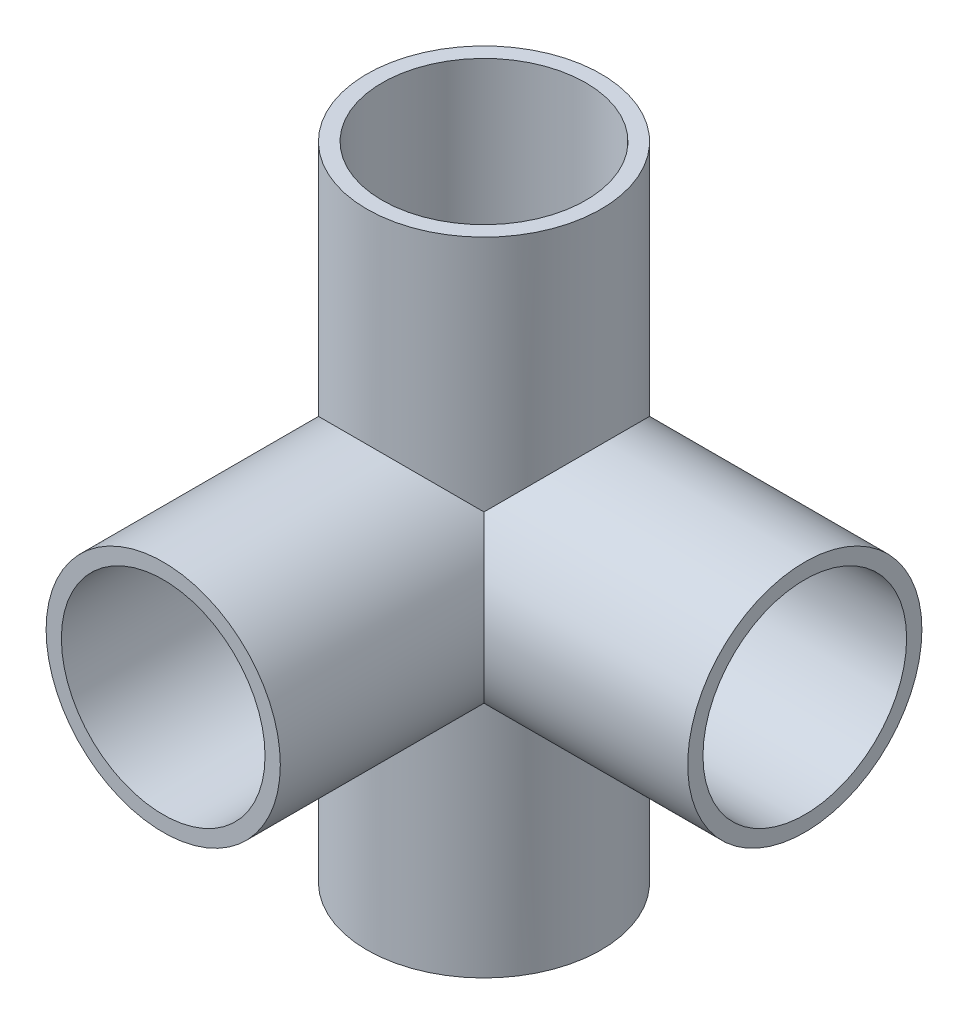
from build123d import *
from OCP.BRepAlgoAPI import BRepAlgoAPI_Cut
from OCP.TopTools import TopTools_ListOfShape

# Parameters (mm, degrees)
SKETCH3_R           = 14.605
SKETCH3_R_2         = 12.7
BOSS_EXTRUDE2_DEPTH = 80.01
SKETCH4_R           = 14.605
BOSS_EXTRUDE3_DEPTH = 40.005
SKETCH5_R           = 12.7
CUT_EXTRUDE1_DEPTH  = 40.005
SKETCH6_R           = 14.605
BOSS_EXTRUDE4_DEPTH = 40.005
SKETCH7_R           = 12.7
CUT_EXTRUDE2_DEPTH  = 40.005
SKETCH8_R           = 12.7
CUT_EXTRUDE3_DEPTH  = 98.991837283
CUT_EXTRUDE4_REACH  = 106.806
SKETCH9_R           = 12.7


with BuildPart() as part:
    # Sketch3 → Boss-Extrude2 (new body)
    with BuildSketch(Plane(origin=(0, 0, 0), x_dir=(1, 0, 0), z_dir=(0, 1, 0))):
        with Locations(Location((0, 0, 0), (0, 0, 270))):
            Circle(SKETCH3_R)
        with Locations(Location((0, 0, 0), (0, 0, 270))):
            Circle(SKETCH3_R_2, mode=Mode.SUBTRACT)
    extrude(amount=BOSS_EXTRUDE2_DEPTH)

    # Sketch4 → Boss-Extrude3 (add)
    with BuildSketch(Plane.XY):
        with Locations((0, 40.005)):
            Circle(SKETCH4_R)
    extrude(amount=BOSS_EXTRUDE3_DEPTH)

    # Sketch5 → Cut-Extrude1 (cut)
    with BuildSketch(Plane.XY.offset(40.005)):
        with Locations((0, 40.005)):
            Circle(SKETCH5_R)
    extrude(amount=-CUT_EXTRUDE1_DEPTH, mode=Mode.SUBTRACT)

    # Sketch6 → Boss-Extrude4 (add)
    with BuildSketch(Plane(origin=(0, 0, 0), x_dir=(0, 0, -1), z_dir=(1, 0, 0))):
        with Locations((0, 40.005)):
            Circle(SKETCH6_R)
    extrude(amount=BOSS_EXTRUDE4_DEPTH)

    # Sketch7 → Cut-Extrude2 (cut)
    with BuildSketch(Plane(origin=(40.005, 0, 0), x_dir=(0, 0, -1), z_dir=(1, 0, 0))):
        with Locations((0, 40.005)):
            Circle(SKETCH7_R)
    extrude(amount=-CUT_EXTRUDE2_DEPTH, mode=Mode.SUBTRACT)


with BuildPart() as cut_extrude3_tool:
    # Sketch8 → Cut-Extrude3 (new, through all)
    with BuildSketch(Plane(origin=(0, 80.01, 0), x_dir=(1, 0, 0), z_dir=(0, 1, 0))):
        with Locations(Location((0, 0, 0), (0, 0, 270))):
            Circle(SKETCH8_R)
    extrude(amount=-CUT_EXTRUDE3_DEPTH)


with BuildPart() as part_1:
    add(part.part)

    # Cut-Extrude3: cut by cut_extrude3_tool, with a tolerance
    cut_extrude3_stock = TopTools_ListOfShape()
    cut_extrude3_stock.Append(part_1.part.wrapped)
    cut_extrude3_tools = TopTools_ListOfShape()
    cut_extrude3_tools.Append(cut_extrude3_tool.part.wrapped)
    cut_extrude3_cut = BRepAlgoAPI_Cut()
    cut_extrude3_cut.SetArguments(cut_extrude3_stock)
    cut_extrude3_cut.SetTools(cut_extrude3_tools)
    cut_extrude3_cut.SetFuzzyValue(0.00001)
    cut_extrude3_cut.Build()
    add(Compound.cast(cut_extrude3_cut.Shape()).solids(), mode=Mode.REPLACE)

    # Sketch9 → Cut-Extrude4 (cut, up to next)
    with BuildSketch(Plane.XY.offset(40.005), mode=Mode.PRIVATE) as cut_extrude4_sk1:
        with Locations((0, 40.005)):
            Circle(SKETCH9_R)
    cut_extrude4_tool1 = extrude(cut_extrude4_sk1.sketch, amount=-CUT_EXTRUDE4_REACH, mode=Mode.PRIVATE) & part_1.part
    add(cut_extrude4_tool1.solids().sort_by_distance((0, 40.005, 40.005))[0], mode=Mode.SUBTRACT)


solid = part_1.part
